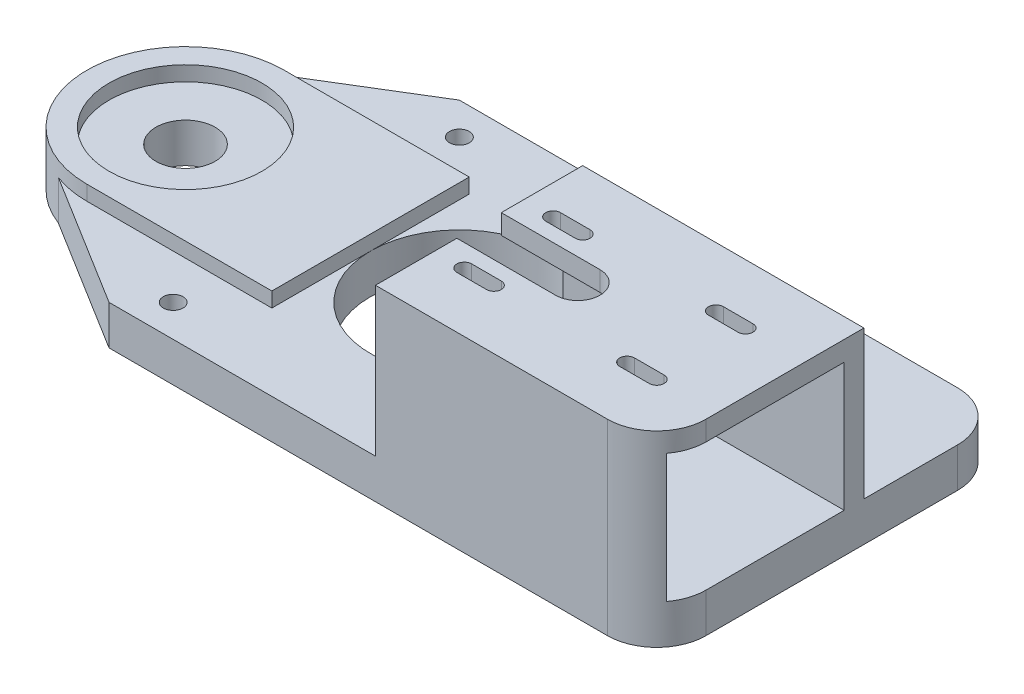
from build123d import *

# Parameters (mm, degrees)
SKETCH1_R           = 18
SKETCH1_R_2         = 6
BOSS_EXTRUDE4_DEPTH = 8
SKETCH5_R           = 20
SKETCH5_R_2         = 15.5
BOSS_EXTRUDE5_DEPTH = 3
SKETCH6_W           = 34
SKETCH6_H           = 4
BOSS_EXTRUDE6_DEPTH = 57
CUT_EXTRUDE1_REACH  = 139.135
CUT_EXTRUDE2_REACH  = 139.135
SKETCH9_R           = 2
BOSS_EXTRUDE8_DEPTH = 3
FILLET1_R           = 10
FILLET2_R           = 10


with BuildPart() as part:
    # Sketch1 → Boss-Extrude4 (new body)
    with BuildSketch(Plane(origin=(0, 0, 0), x_dir=(1, 0, 0), z_dir=(0, 1, 0))):
        with BuildLine():
            Line((0, 0), (-32.22015265, -19.667505907))
            ThreePointArc((-32.22015265, -19.667505907), (-39.781284933, -38.449706153), (-27.069479945, -54.208887014))
            Line((-27.069479945, -54.208887014), (0, -71))
            Line((0, -71), (111, -71))
            Line((111, -71), (111, 0))
            Line((111, 0), (0, 0))
        make_face()
        with Locations(Location((35.5, -35.5, 0), (0, 0, 270))):
            Circle(SKETCH1_R, mode=Mode.SUBTRACT)
        with Locations(Location((-20, -35.5, 0), (0, 0, 270))):
            Circle(SKETCH1_R_2, mode=Mode.SUBTRACT)
    extrude(amount=BOSS_EXTRUDE4_DEPTH)

    # Sketch5 → Boss-Extrude5 (add)
    with BuildSketch(Plane(origin=(0, 8, 0), x_dir=(1, 0, 0), z_dir=(0, 1, 0))):
        with Locations(Location((-20, -35.5, 0), (0, 0, 115.138226689))):
            Circle(SKETCH5_R)
        with Locations(Location((-20, -35.5, 0), (0, 0, 270))):
            Circle(SKETCH5_R_2, mode=Mode.SUBTRACT)
    extrude(amount=BOSS_EXTRUDE5_DEPTH)

    # Sketch6 → Boss-Extrude6 (add)
    with BuildSketch(Plane(origin=(111, 0, 0), x_dir=(0, 0, -1), z_dir=(1, 0, 0))):
        Polygon((-71, 38), (-71, 8), (-67, 8), (-67, 34), (-67, 38), align=None)
        with Locations((-50, 36)):
            Rectangle(SKETCH6_W, SKETCH6_H)
        Polygon((-33, 34), (-33, 8), (-29, 8), (-29, 38), (-33, 38), align=None)
    extrude(amount=-BOSS_EXTRUDE6_DEPTH)

    # Sketch7 → Cut-Extrude1 (cut, up to next)
    with BuildSketch(Plane(origin=(0, 38, 0), x_dir=(1, 0, 0), z_dir=(0, 1, 0)), mode=Mode.PRIVATE) as cut_extrude1_sk1:
        with BuildLine():
            Line((74, -45.5), (54, -45.5))
            Line((54, -45.5), (54, -50))
            Line((54, -50), (54, -54.5))
            Line((54, -54.5), (74, -54.5))
            ThreePointArc((74, -54.5), (78.5, -50), (74, -45.5))
        make_face()
    cut_extrude1_tool1 = extrude(cut_extrude1_sk1.sketch, amount=-CUT_EXTRUDE1_REACH, mode=Mode.PRIVATE) & part.part
    # Sketch7 → Cut-Extrude1 (cut, up to next)
    with BuildSketch(Plane(origin=(0, 38, 0), x_dir=(1, 0, 0), z_dir=(0, 1, 0)), mode=Mode.PRIVATE) as cut_extrude1_sk2:
        with BuildLine():
            Line((60, -57.5), (66, -57.5))
            ThreePointArc((66, -57.5), (67.5, -59), (66, -60.5))
            Line((66, -60.5), (60, -60.5))
            ThreePointArc((60, -60.5), (58.5, -59), (60, -57.5))
        make_face()
    cut_extrude1_tool2 = extrude(cut_extrude1_sk2.sketch, amount=-CUT_EXTRUDE1_REACH, mode=Mode.PRIVATE) & part.part
    # Sketch7 → Cut-Extrude1 (cut, up to next)
    with BuildSketch(Plane(origin=(0, 38, 0), x_dir=(1, 0, 0), z_dir=(0, 1, 0)), mode=Mode.PRIVATE) as cut_extrude1_sk3:
        with BuildLine():
            Line((60, -39.5), (66, -39.5))
            ThreePointArc((66, -39.5), (67.5, -41), (66, -42.5))
            Line((66, -42.5), (60, -42.5))
            ThreePointArc((60, -42.5), (58.5, -41), (60, -39.5))
        make_face()
    cut_extrude1_tool3 = extrude(cut_extrude1_sk3.sketch, amount=-CUT_EXTRUDE1_REACH, mode=Mode.PRIVATE) & part.part
    # Sketch7 → Cut-Extrude1 (cut, up to next)
    with BuildSketch(Plane(origin=(0, 38, 0), x_dir=(1, 0, 0), z_dir=(0, 1, 0)), mode=Mode.PRIVATE) as cut_extrude1_sk4:
        with BuildLine():
            Line((93, -57.5), (99, -57.5))
            ThreePointArc((99, -57.5), (100.5, -59), (99, -60.5))
            Line((99, -60.5), (93, -60.5))
            ThreePointArc((93, -60.5), (91.5, -59), (93, -57.5))
        make_face()
    cut_extrude1_tool4 = extrude(cut_extrude1_sk4.sketch, amount=-CUT_EXTRUDE1_REACH, mode=Mode.PRIVATE) & part.part
    # Sketch7 → Cut-Extrude1 (cut, up to next)
    with BuildSketch(Plane(origin=(0, 38, 0), x_dir=(1, 0, 0), z_dir=(0, 1, 0)), mode=Mode.PRIVATE) as cut_extrude1_sk5:
        with BuildLine():
            Line((93, -42.5), (99, -42.5))
            ThreePointArc((99, -42.5), (100.5, -41), (99, -39.5))
            Line((99, -39.5), (93, -39.5))
            ThreePointArc((93, -39.5), (91.5, -41), (93, -42.5))
        make_face()
    cut_extrude1_tool5 = extrude(cut_extrude1_sk5.sketch, amount=-CUT_EXTRUDE1_REACH, mode=Mode.PRIVATE) & part.part
    add(cut_extrude1_tool1.solids().sort_by_distance((65.788578, 38, 50))[0], mode=Mode.SUBTRACT)
    add(cut_extrude1_tool2.solids().sort_by_distance((63, 38, 59))[0], mode=Mode.SUBTRACT)
    add(cut_extrude1_tool3.solids().sort_by_distance((63, 38, 41))[0], mode=Mode.SUBTRACT)
    add(cut_extrude1_tool4.solids().sort_by_distance((96, 38, 59))[0], mode=Mode.SUBTRACT)
    add(cut_extrude1_tool5.solids().sort_by_distance((96, 38, 41))[0], mode=Mode.SUBTRACT)

    # Sketch9 → Cut-Extrude2 (cut, up to next)
    with BuildSketch(Plane.XZ, mode=Mode.PRIVATE) as cut_extrude2_sk1:
        with Locations(Location((64.5, 64.5, 0), (0, 0, 270))):
            Circle(SKETCH9_R)
    cut_extrude2_tool1 = extrude(cut_extrude2_sk1.sketch, amount=-CUT_EXTRUDE2_REACH, mode=Mode.PRIVATE) & part.part
    # Sketch9 → Cut-Extrude2 (cut, up to next)
    with BuildSketch(Plane.XZ, mode=Mode.PRIVATE) as cut_extrude2_sk2:
        with Locations(Location((6.5, 64.5, 0), (0, 0, 270))):
            Circle(SKETCH9_R)
    cut_extrude2_tool2 = extrude(cut_extrude2_sk2.sketch, amount=-CUT_EXTRUDE2_REACH, mode=Mode.PRIVATE) & part.part
    # Sketch9 → Cut-Extrude2 (cut, up to next)
    with BuildSketch(Plane.XZ, mode=Mode.PRIVATE) as cut_extrude2_sk3:
        with Locations(Location((6.5, 6.5, 0), (0, 0, 270))):
            Circle(SKETCH9_R)
    cut_extrude2_tool3 = extrude(cut_extrude2_sk3.sketch, amount=-CUT_EXTRUDE2_REACH, mode=Mode.PRIVATE) & part.part
    # Sketch9 → Cut-Extrude2 (cut, up to next)
    with BuildSketch(Plane.XZ, mode=Mode.PRIVATE) as cut_extrude2_sk4:
        with Locations(Location((64.5, 6.5, 0), (0, 0, 270))):
            Circle(SKETCH9_R)
    cut_extrude2_tool4 = extrude(cut_extrude2_sk4.sketch, amount=-CUT_EXTRUDE2_REACH, mode=Mode.PRIVATE) & part.part
    add(cut_extrude2_tool1.solids().sort_by_distance((64.5, 0, 64.5))[0], mode=Mode.SUBTRACT)
    add(cut_extrude2_tool2.solids().sort_by_distance((6.5, 0, 64.5))[0], mode=Mode.SUBTRACT)
    add(cut_extrude2_tool3.solids().sort_by_distance((6.5, 0, 6.5))[0], mode=Mode.SUBTRACT)
    add(cut_extrude2_tool4.solids().sort_by_distance((64.5, 0, 6.5))[0], mode=Mode.SUBTRACT)

    # Sketch10 → Boss-Extrude8 (add)
    with BuildSketch(Plane(origin=(0, 8, 0), x_dir=(1, 0, 0), z_dir=(0, 1, 0))):
        with BuildLine():
            Line((17.5, -15.5), (-20, -15.5))
            ThreePointArc((-20, -15.5), (-5.857864376, -21.357864376), (0, -35.5))
            ThreePointArc((0, -35.5), (-5.857864376, -49.642135624), (-20, -55.5))
            Line((-20, -55.5), (17.5, -55.5))
            Line((17.5, -55.5), (17.5, -15.5))
        make_face()
    extrude(amount=BOSS_EXTRUDE8_DEPTH)

    # Fillet1
    # the kernel refuses this fillet: 10 mm, written as the material it takes off along each edge
    with BuildSketch(Plane(origin=(111, 63, 71), x_dir=(-1, 0, 0), z_dir=(0, -1, 0))) as fillet1_piece_1:
        with BuildLine():
            CenterArc((FILLET1_R, FILLET1_R), FILLET1_R, 180, 90)
            Line((0, FILLET1_R), (0, 0))
            Line((0, 0), (FILLET1_R, 0))
        make_face()
    extrude(amount=88, mode=Mode.SUBTRACT)

    # Fillet2
    fillet2_edges = [part.edges().sort_by_distance(p)[0] for p in [
        (111, 4, 0),
    ]]
    fillet(fillet2_edges, radius=FILLET2_R)


solid = part.part
